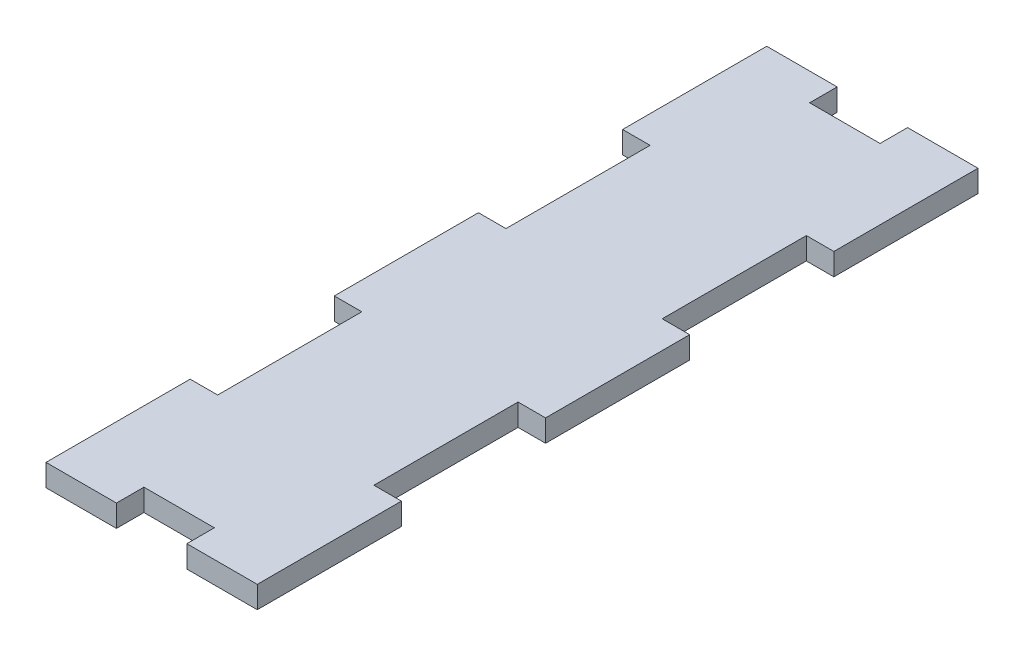
from build123d import *

# Parameters (mm, degrees)
SKETCH1_W           = 24.384
SKETCH1_H           = 83.185
BOSS_EXTRUDE1_DEPTH = 2.54
SKETCH2_W           = 3.175
SKETCH2_H           = 16.637
CUT_EXTRUDE1_DEPTH  = 2.54
LPATTERN1_COUNT     = 2
LPATTERN1_PITCH     = 33.274
SKETCH3_W           = 8.128
SKETCH3_H           = 6.35
CUT_EXTRUDE2_DEPTH  = 2.54


with BuildPart() as part:
    # Sketch1 → Boss-Extrude1 (new body)
    with BuildSketch(Plane(origin=(0, 0, 0), x_dir=(1, 0, 0), z_dir=(0, 1, 0))):
        Rectangle(SKETCH1_W, SKETCH1_H)
    extrude(amount=BOSS_EXTRUDE1_DEPTH)

    # Sketch2 → Cut-Extrude1 (cut)
    with BuildSketch(Plane(origin=(0, 2.54, 0), x_dir=(1, 0, 0), z_dir=(0, 1, 0))):
        with Locations((-10.6045, 16.637)):
            Rectangle(SKETCH2_W, SKETCH2_H)
        with Locations((10.6045, 16.637)):
            Rectangle(SKETCH2_W, SKETCH2_H)
    cut_extrude1 = extrude(amount=-CUT_EXTRUDE1_DEPTH, mode=Mode.SUBTRACT)

    # LPattern1: Cut-Extrude1 ×2
    with Locations(*[(0, 0, i * LPATTERN1_PITCH) for i in range(1, LPATTERN1_COUNT)]):
        add(cut_extrude1, mode=Mode.SUBTRACT)

    # Sketch3 → Cut-Extrude2 (cut)
    with BuildSketch(Plane(origin=(0, 2.54, 0), x_dir=(1, 0, 0), z_dir=(0, 1, 0))):
        with Locations((0, 41.5925)):
            Rectangle(SKETCH3_W, SKETCH3_H)
        with Locations((0, -41.5925)):
            Rectangle(SKETCH3_W, SKETCH3_H)
    extrude(amount=-CUT_EXTRUDE2_DEPTH, mode=Mode.SUBTRACT)


solid = part.part
